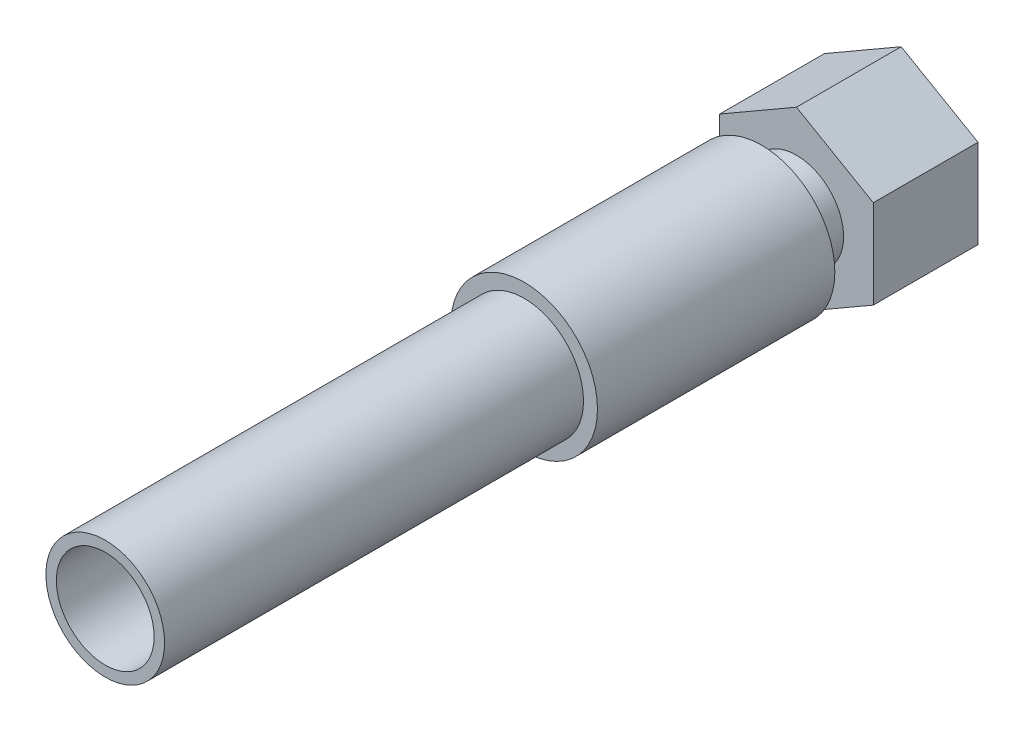
from build123d import *

# Parameters (mm, degrees)
BASE_EXTRUDE_DEPTH      = 15
SKETCH2_R               = 8.331
SKETCH2_R_2             = 7
CUT_EXTRUDE1_DEPTH      = 12
SKETCH4_R               = 6.75
BOSS_EXTRUDE1_DEPTH     = 5
BOSS_EXTRUDE2_START     = 20
BOSS_EXTRUDE2_OUTLINE_R = 10.5
BOSS_EXTRUDE2_DEPTH     = 34
SKETCH6_R               = 8.5
BOSS_EXTRUDE3_DEPTH     = 60
CUT_EXTRUDE3_START      = -60
SKETCH7_R               = 7
CUT_EXTRUDE3_DEPTH      = 60
SKETCH3_R               = 3.5
CUT_EXTRUDE2_DEPTH      = 116.231650745


# Read off the part's stored shape, not the designer's step: Boss-Extrude2
with BuildPart() as part:
    # Sketch1 → Base-Extrude (new body)
    with BuildSketch(Plane.XY):
        Polygon((0, 12.701705922), (-11, 6.350852961), (-11, -6.350852961), (0, -12.701705922), (11, -6.350852961), (11, 6.350852961), align=None)
    extrude(amount=BASE_EXTRUDE_DEPTH)

    # Sketch2 → Cut-Extrude1 (cut)
    with BuildSketch(Plane(origin=(0, 0, 0), x_dir=(-1, 0, 0), z_dir=(0, 0, -1))):
        Circle(SKETCH2_R)
        Circle(SKETCH2_R_2, mode=Mode.SUBTRACT)
    extrude(amount=-CUT_EXTRUDE1_DEPTH, mode=Mode.SUBTRACT)

    # Sketch4 → Boss-Extrude1 (add)
    with BuildSketch(Plane.XY.offset(15)):
        with Locations(Location((0, 0, 0), (0, 0, 180))):
            Circle(SKETCH4_R)
    extrude(amount=BOSS_EXTRUDE1_DEPTH)

    # Boss-Extrude2 outline → Boss-Extrude2 (add)
    with BuildSketch(Plane.XY.offset(BOSS_EXTRUDE2_START)):
        Circle(BOSS_EXTRUDE2_OUTLINE_R)
    extrude(amount=BOSS_EXTRUDE2_DEPTH)

    # Sketch6 → Boss-Extrude3 (add)
    with BuildSketch(Plane.XY.offset(54)):
        Circle(SKETCH6_R)
    extrude(amount=BOSS_EXTRUDE3_DEPTH)

    # Sketch7 → Cut-Extrude3 (cut)
    with BuildSketch(Plane.XY.offset(114).offset(CUT_EXTRUDE3_START)):
        with Locations(Location((0, 0, 0), (0, 0, 180))):
            Circle(SKETCH7_R)
    extrude(amount=CUT_EXTRUDE3_DEPTH, mode=Mode.SUBTRACT)

    # Sketch3 → Cut-Extrude2 (cut, through all)
    with BuildSketch(Plane(origin=(0, 0, 0), x_dir=(-1, 0, 0), z_dir=(0, 0, -1))):
        Circle(SKETCH3_R)
    extrude(amount=-CUT_EXTRUDE2_DEPTH, mode=Mode.SUBTRACT)


solid = part.part
